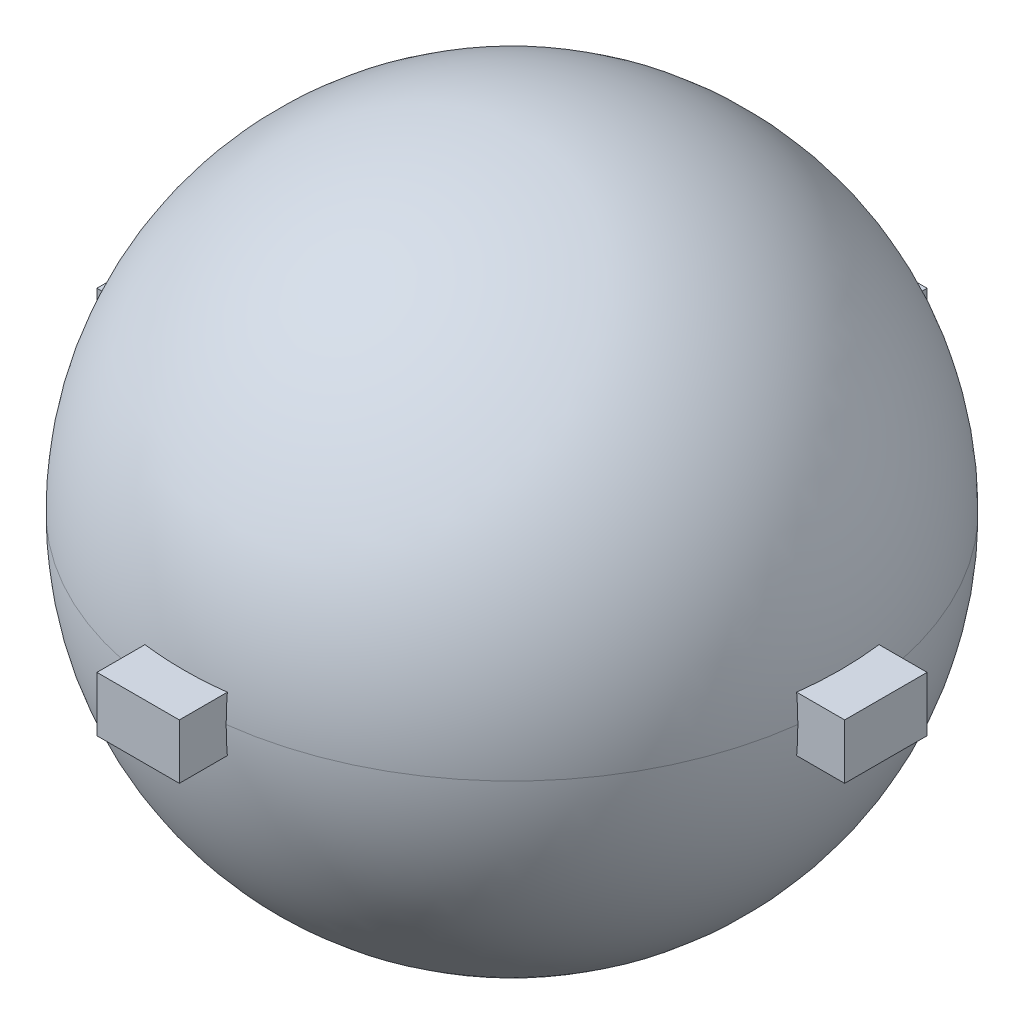
from build123d import *

# Parameters (mm, degrees)
SKETCH1_R                = 304.8
BOSS_EXTRUDE1_DEPTH      = 609.6
FILLET1_R                = 304.8
SHELL2_T                 = 3.175
BOSS_EXTRUDE2_REACH      = 944.2
BOSS_EXTRUDE2_END_RADIUS = 304.8
SKETCH3_W                = 76.2
SKETCH3_H                = 50.8
CIRPATTERN1_COUNT        = 4


with BuildPart() as part:
    # Sketch1 → Boss-Extrude1 (new body)
    with BuildSketch(Plane(origin=(0, 0, 0), x_dir=(1, 0, 0), z_dir=(0, 1, 0))):
        with Locations(Location((0, 0, 0), (0, 0, 90))):
            Circle(SKETCH1_R)
    extrude(amount=BOSS_EXTRUDE1_DEPTH)

    # Fillet1
    fillet1_edges = [part.edges().sort_by_distance(p)[0] for p in [
        (0, 0, 304.8),
        (0, 609.6, 304.8),
    ]]
    fillet(fillet1_edges, radius=FILLET1_R - 0.0001)  # a hair under: the kernel refuses the full size

    # Shell2 (no face opened: a closed hollow body)
    add(offset(amount=-SHELL2_T, mode=Mode.PRIVATE), mode=Mode.SUBTRACT)

    # Boss-Extrude2: up to this sphere (the profile starts outside it)
    boss_extrude2_end = Location((0, 304.8, 0)) * Sphere(BOSS_EXTRUDE2_END_RADIUS, mode=Mode.PRIVATE)
    # Sketch3 → Boss-Extrude2 (add, up to the surface)
    with BuildSketch(Plane(origin=(345.7575, 0, 0), x_dir=(0, 0, -1), z_dir=(1, 0, 0)), mode=Mode.PRIVATE) as boss_extrude2_sk1:
        with Locations((0, 304.8)):
            Rectangle(SKETCH3_W, SKETCH3_H)
    boss_extrude2_tool1 = extrude(boss_extrude2_sk1.sketch, amount=-BOSS_EXTRUDE2_REACH, mode=Mode.PRIVATE) - boss_extrude2_end
    boss_extrude2 = boss_extrude2_tool1.solids().sort_by_distance((345.7575, 304.8, 0))[0]
    add(boss_extrude2)

    # CirPattern1: Boss-Extrude2 ×4 about axis
    cirpattern1_axis = Axis((0, 0, 0), (0, 1, 0))
    for i in range(1, CIRPATTERN1_COUNT):
        add(boss_extrude2.rotate(cirpattern1_axis, i * 360 / CIRPATTERN1_COUNT))


solid = part.part
